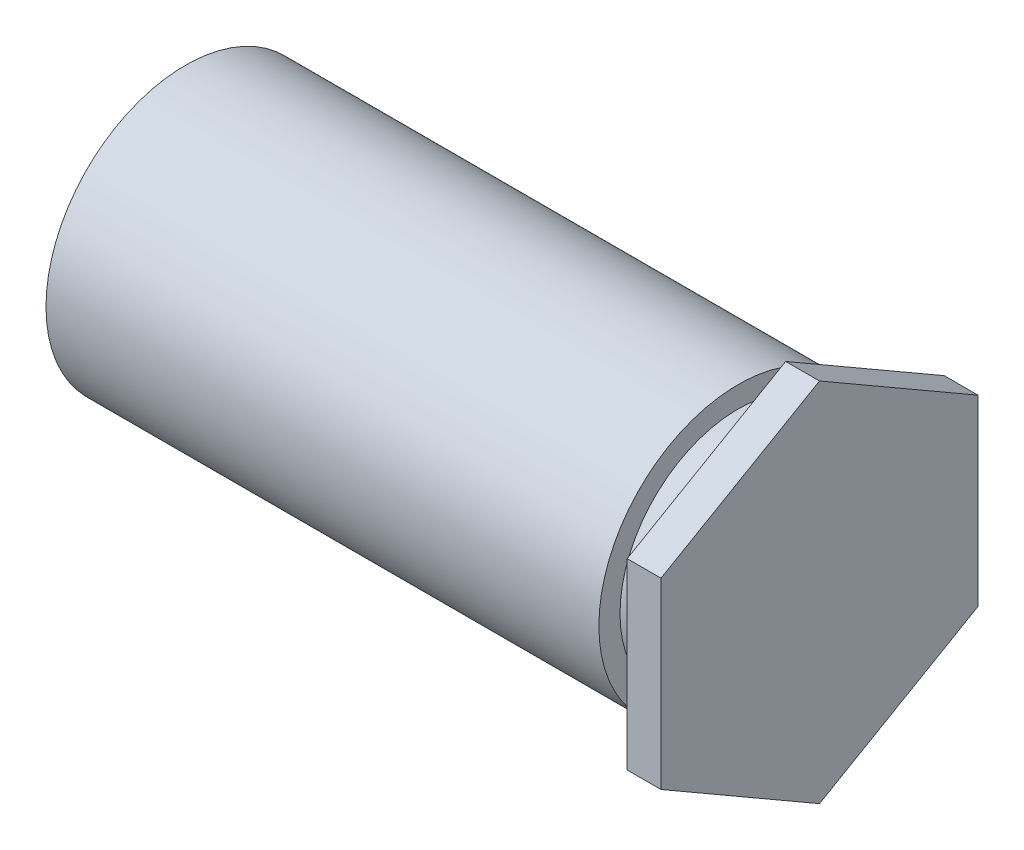
from build123d import *

# Parameters (mm, degrees)
SKETCH2_R      = 2.0955
EXTRUDE1_DEPTH = 9.525
EXTRUDE2_DEPTH = 0.508
EXTRUDE3_START = 0.7112
SKETCH4_R      = 2.0955
SKETCH4_R_2    = 1.778
EXTRUDE3_DEPTH = 0.7112
SKETCH5_R      = 1.4224
EXTRUDE4_DEPTH = 3.96875
SWEEP1_PITCH   = 0.635
SKETCH8_R      = 1.4732
EXTRUDE6_DEPTH = 11.195903359


with BuildPart() as part:
    # Sketch2 → Extrude1 (new body)
    with BuildSketch(Plane(origin=(-4.7625, 0, 0), x_dir=(0, 0, -1), z_dir=(1, 0, 0))):
        Circle(SKETCH2_R)
    extrude(amount=EXTRUDE1_DEPTH)

    # Sketch3 → Extrude2 (add)
    with BuildSketch(Plane(origin=(4.7625, 0, 0), x_dir=(0, 0, -1), z_dir=(1, 0, 0))):
        Polygon((0, 2.749630657), (-2.38125, 1.374815329), (-2.38125, -1.374815329), (0, -2.749630657), (2.38125, -1.374815329), (2.38125, 1.374815329), align=None)
    extrude(amount=-EXTRUDE2_DEPTH)

    # Sketch4 → Extrude3 (cut)
    with BuildSketch(Plane.ZY.offset(-4.2545).offset(EXTRUDE3_START)):
        Circle(SKETCH4_R)
        Circle(SKETCH4_R_2, mode=Mode.SUBTRACT)
    extrude(amount=-EXTRUDE3_DEPTH, mode=Mode.SUBTRACT)

    # Sketch5 → Extrude4 (cut)
    with BuildSketch(Plane.ZY.offset(4.7625)):
        Circle(SKETCH5_R)
    extrude(amount=-EXTRUDE4_DEPTH, mode=Mode.SUBTRACT)

    # Sweep1: the profile of Sketch7 profile screwed along a right-hand helix of 6.25 turns, 6 arcs to a turn; built about Z, then put on its axis
    sweep1_z = Axis((0, 0, 0), (0, 0, 1))
    sweep1_corners = [(1.4227, 0, -0.555798205), (1.4227, 0, 0.000173205), (1.009955401, 0, -0.238125), (1.009955401, 0, -0.3175)]
    with BuildLine(mode=Mode.PRIVATE) as sweep1_profile:
        Line(sweep1_corners[0], sweep1_corners[1])
        Line(sweep1_corners[1], sweep1_corners[2])
        Line(sweep1_corners[2], sweep1_corners[3])
        Line(sweep1_corners[3], sweep1_corners[0])
    sweep1_cap = Face(sweep1_profile.wire())
    sweep1_turn_angles = [0, 30, 60, 90, 120, 150, 180, 210, 240, 270, 300, 330, 360]
    sweep1_turn_weights = [1, 0.8660254037844387, 1, 0.8660254037844387, 1, 0.8660254037844387, 1, 0.8660254037844387, 1, 0.8660254037844387, 1, 0.8660254037844387, 1]
    sweep1_turn_rails = [Edge.make_bspline([Vector(p[0], p[1], 0).rotate(sweep1_z, sweep1_turn_angles[k]) / sweep1_turn_weights[k] + Vector(0, 0, p[2] + SWEEP1_PITCH * sweep1_turn_angles[k] / 360) for k in range(13)], [0, 0, 0, 1, 1, 2, 2, 3, 3, 4, 4, 5, 5, 6, 6, 6], 2, sweep1_turn_weights) for p in sweep1_corners]
    sweep1_turn_sides = [Face.make_surface_from_curves(sweep1_turn_rails[p[0]], sweep1_turn_rails[p[1]]) for p in [(0, 1), (1, 2), (2, 3), (3, 0)]]
    sweep1_last_angles = [2160, 2190, 2220, 2235, 2250]
    sweep1_last_weights = [1, 0.8660254037844387, 1, 0.9659258262890652, 1]
    sweep1_last_rails = [Edge.make_bspline([Vector(p[0], p[1], 0).rotate(sweep1_z, sweep1_last_angles[k]) / sweep1_last_weights[k] + Vector(0, 0, p[2] + SWEEP1_PITCH * sweep1_last_angles[k] / 360) for k in range(5)], [0, 0, 0, 1, 1, 2, 2, 2], 2, sweep1_last_weights) for p in sweep1_corners]
    sweep1_last_sides = [Face.make_surface_from_curves(sweep1_last_rails[p[0]], sweep1_last_rails[p[1]]) for p in [(0, 1), (1, 2), (2, 3), (3, 0)]]
    sweep1 = Plane(origin=(-4.7625, 0, 0), x_dir=(0, 1, 0), z_dir=(1, 0, 0)) * Solid(Shell([*[p.moved(Location((0, 0, SWEEP1_PITCH * i))) for i in range(6) for p in sweep1_turn_sides], *sweep1_last_sides, sweep1_cap, sweep1_cap.rotate(sweep1_z, 2250).moved(Location((0, 0, SWEEP1_PITCH * 2250 / 360)))]))
    add(sweep1)

    # Sketch8 → Extrude6 (cut)
    with BuildSketch(Plane.ZY.offset(4.7625)):
        Circle(SKETCH8_R)
    extrude(amount=EXTRUDE6_DEPTH, mode=Mode.SUBTRACT)

    # Extrude6 cone 1 section (through the dimple's axis) → Extrude6 other way (revolve, cut)
    with BuildSketch(Plane(origin=(-4.7625, 0, 0), x_dir=(0, 0, 1), z_dir=(0, 1, 0))):
        Polygon((0, 0), (1.4732, 0), (0, 1.4732), align=None)
    revolve(axis=Axis((-4.7625, 0, 0), (1, 0, 0)), mode=Mode.SUBTRACT)


solid = part.part
